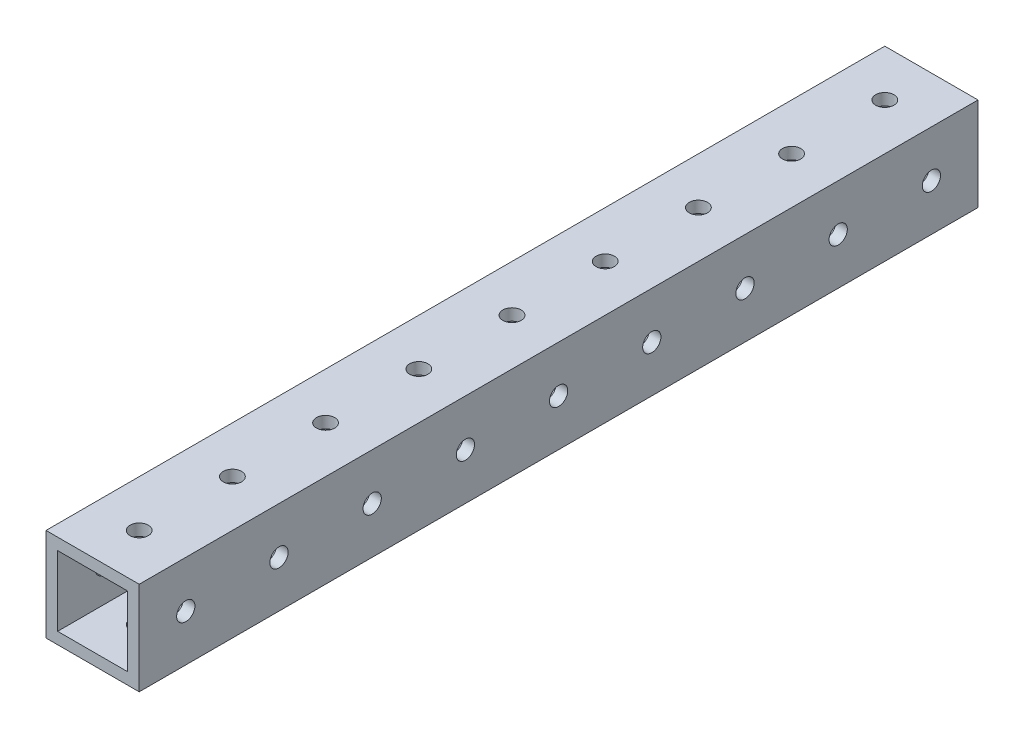
from build123d import *

# Parameters (mm, degrees)
SKETCH1_W           = 25.4
SKETCH1_H           = 25.4
BOSS_EXTRUDE1_DEPTH = 114.3
SHELL1_T            = -3.175
SKETCH2_R           = 2.4892
CUT_EXTRUDE1_DEPTH  = 118.774954893
SKETCH3_R           = 2.4892
CUT_EXTRUDE2_DEPTH  = 118.774954893


with BuildPart() as part:
    # Sketch1 → Boss-Extrude1 (new, symmetric)
    with BuildSketch(Plane.XY):
        Rectangle(SKETCH1_W, SKETCH1_H)
    extrude(amount=BOSS_EXTRUDE1_DEPTH, both=True)

    # Shell1
    shell1_openings = [part.faces().sort_by_distance(p)[0] for p in [
        (0, 0, -114.3),
        (0, 0, 114.3),
    ]]
    offset(amount=SHELL1_T, openings=shell1_openings, kind=Kind.INTERSECTION)

    # Sketch2 → Cut-Extrude1 (cut, through all)
    with BuildSketch(Plane(origin=(0, 12.7, 0), x_dir=(1, 0, 0), z_dir=(0, 1, 0))):
        with Locations((0, -101.6)):
            Circle(SKETCH2_R)
        with Locations((0, -76.2)):
            Circle(SKETCH2_R)
        with Locations((0, -50.8)):
            Circle(SKETCH2_R)
        with Locations((0, -25.4)):
            Circle(SKETCH2_R)
        Circle(SKETCH2_R)
        with Locations((0, 25.4)):
            Circle(SKETCH2_R)
        with Locations((0, 50.8)):
            Circle(SKETCH2_R)
        with Locations((0, 76.2)):
            Circle(SKETCH2_R)
        with Locations((0, 101.6)):
            Circle(SKETCH2_R)
        with Locations((0, 127)):
            Circle(SKETCH2_R)
    extrude(amount=-CUT_EXTRUDE1_DEPTH, mode=Mode.SUBTRACT)

    # Sketch3 → Cut-Extrude2 (cut, through all)
    with BuildSketch(Plane.ZY.offset(12.7)):
        with Locations((101.6, 0)):
            Circle(SKETCH3_R)
        with Locations((76.2, 0)):
            Circle(SKETCH3_R)
        with Locations((50.8, 0)):
            Circle(SKETCH3_R)
        with Locations((25.4, 0)):
            Circle(SKETCH3_R)
        Circle(SKETCH3_R)
        with Locations((-25.4, 0)):
            Circle(SKETCH3_R)
        with Locations((-50.8, 0)):
            Circle(SKETCH3_R)
        with Locations((-76.2, 0)):
            Circle(SKETCH3_R)
        with Locations((-101.6, 0)):
            Circle(SKETCH3_R)
        with Locations((-127, 0)):
            Circle(SKETCH3_R)
    extrude(amount=-CUT_EXTRUDE2_DEPTH, mode=Mode.SUBTRACT)


solid = part.part
